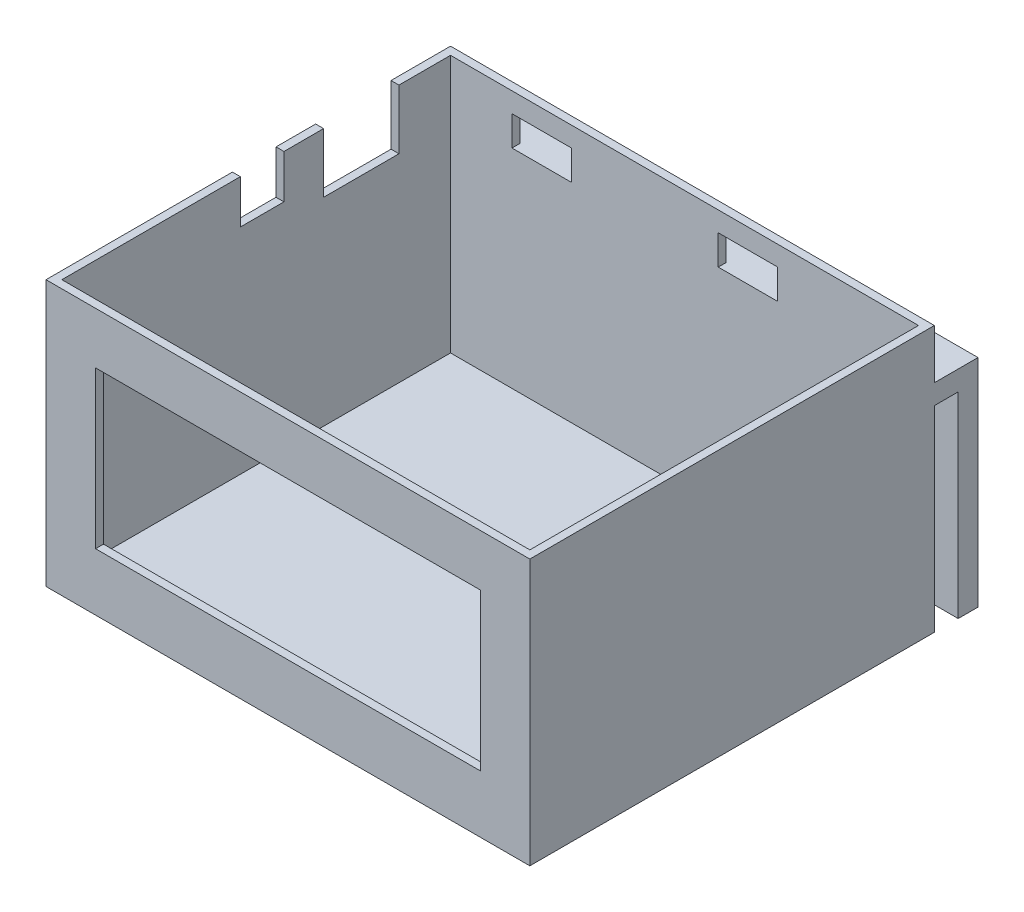
from build123d import *

# Parameters (mm, degrees)
STOCK_BOX_1_OUTLINE_W   = 122
STOCK_BOX_1_OUTLINE_H   = 102
STOCK_BOX_1_OUTLINE_W_2 = 118
STOCK_BOX_1_OUTLINE_H_2 = 98
STOCK_BOX_1_DEPTH       = 67
STOCK_BOX_1_2_OUTLINE_W = 118
STOCK_BOX_1_2_OUTLINE_H = 98
STOCK_BOX_1_2_DEPTH     = 2
SKETCH1_W               = 97
SKETCH1_H               = 39.5
CUT_EXTRUDE1_DEPTH      = 10
SKETCH2_W               = 15
SKETCH2_H               = 7.5
CUT_EXTRUDE2_DEPTH      = 10
SKETCH3_W               = 122
SKETCH3_H               = 5
BOSS_EXTRUDE1_DEPTH     = 11
SKETCH5_W               = 122
SKETCH5_H               = 5
BOSS_EXTRUDE2_DEPTH     = 49.5
SKETCH6_W               = 19
SKETCH6_H               = 15
SKETCH6_W_2             = 11
SKETCH6_H_2             = 11
CUT_EXTRUDE3_DEPTH      = 50


# Read off the part's stored shape, not the designer's step: Stock-Box-1
with BuildPart() as part:
    # Stock-Box-1 outline → Stock-Box-1 (new body)
    with BuildSketch(Plane(origin=(0, 0, 0), x_dir=(1, 0, 0), z_dir=(0, 1, 0))):
        with Locations((6.476673428, -22.886409736)):
            Rectangle(STOCK_BOX_1_OUTLINE_W, STOCK_BOX_1_OUTLINE_H)
        with Locations((6.476673428, -22.886409736)):
            Rectangle(STOCK_BOX_1_OUTLINE_W_2, STOCK_BOX_1_OUTLINE_H_2, mode=Mode.SUBTRACT)
    extrude(amount=STOCK_BOX_1_DEPTH)

    # Stock-Box-1 2 outline → Stock-Box-1 2 (add)
    with BuildSketch(Plane(origin=(0, 0, 0), x_dir=(1, 0, 0), z_dir=(0, 1, 0))):
        with Locations((6.476673428, -22.886409736)):
            Rectangle(STOCK_BOX_1_2_OUTLINE_W, STOCK_BOX_1_2_OUTLINE_H)
    extrude(amount=STOCK_BOX_1_2_DEPTH)

    # Sketch1 → Cut-Extrude1 (cut)
    with BuildSketch(Plane.XY.offset(73.886409736)):
        with Locations((6.476673428, 34.25)):
            Rectangle(SKETCH1_W, SKETCH1_H)
    extrude(amount=-CUT_EXTRUDE1_DEPTH, mode=Mode.SUBTRACT)

    # Sketch2 → Cut-Extrude2 (cut)
    with BuildSketch(Plane(origin=(0, 0, -28.113590264), x_dir=(-1, 0, 0), z_dir=(0, 0, -1))):
        with Locations((-22.476673428, 58.25)):
            Rectangle(SKETCH2_W, SKETCH2_H)
        with Locations((29.523326572, 58.25)):
            Rectangle(SKETCH2_W, SKETCH2_H)
    extrude(amount=-CUT_EXTRUDE2_DEPTH, mode=Mode.SUBTRACT)

    # Sketch3 → Boss-Extrude1 (add)
    with BuildSketch(Plane(origin=(0, 0, -28.113590264), x_dir=(-1, 0, 0), z_dir=(0, 0, -1))):
        with Locations((-6.476673428, 52)):
            Rectangle(SKETCH3_W, SKETCH3_H)
    extrude(amount=BOSS_EXTRUDE1_DEPTH)

    # Sketch5 → Boss-Extrude2 (add)
    with BuildSketch(Plane.XZ.offset(-49.5)):
        with Locations((6.476673428, -36.613590264)):
            Rectangle(SKETCH5_W, SKETCH5_H)
    extrude(amount=BOSS_EXTRUDE2_DEPTH)

    # Sketch6 → Cut-Extrude3 (cut)
    with BuildSketch(Plane.ZY.offset(54.523326572)):
        with Locations((-3.613590264, 59.5)):
            Rectangle(SKETCH6_W, SKETCH6_H)
        with Locations((21.386409736, 61.5)):
            Rectangle(SKETCH6_W_2, SKETCH6_H_2)
    extrude(amount=-CUT_EXTRUDE3_DEPTH, mode=Mode.SUBTRACT)


solid = part.part
